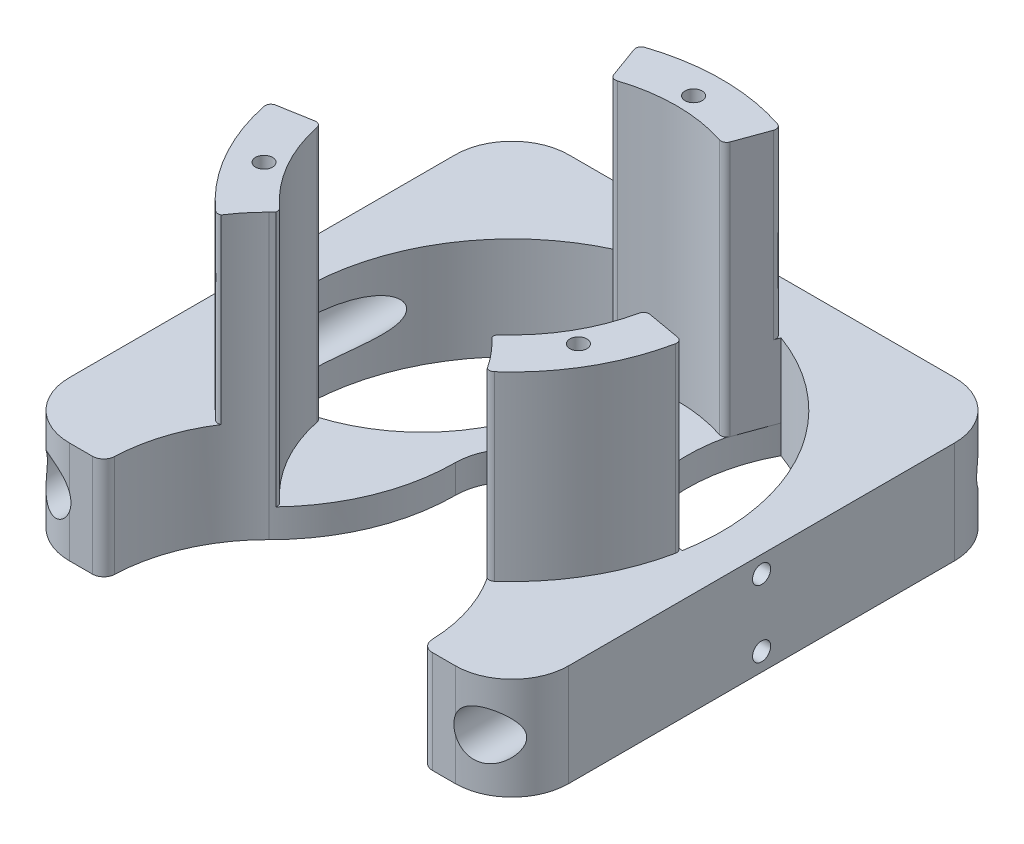
from build123d import *

# Parameters (mm, degrees)
SKETCH1_W           = 88
SKETCH1_H           = 88
BOSS_EXTRUDE1_DEPTH = 18
SKETCH2_R           = 4.25
CUT_EXTRUDE1_DEPTH  = 101.019998
FILLET1_R           = 10
SKETCH3_R           = 37
CUT_EXTRUDE2_DEPTH  = 65.776539126
SKETCH5_R           = 40.5
SKETCH5_R_2         = 10
BOSS_EXTRUDE2_DEPTH = 5
BOSS_EXTRUDE3_START = 45
BOSS_EXTRUDE3_DEPTH = 45
SKETCH7_R           = 1.5
CUT_EXTRUDE3_DEPTH  = 80.824808347
CIRPATTERN1_COUNT   = 3
CUT_EXTRUDE6_DEPTH  = 77.791926774
CIRPATTERN2_COUNT   = 3
FILLET4_R           = 1
SKETCH12_R          = 27.977706125
CUT_EXTRUDE8_DEPTH  = 80.824808284
CUT_EXTRUDE9_DEPTH  = 80.824808284
SKETCH14_R          = 4.25
CUT_EXTRUDE10_DEPTH = 111.36303741
FILLET5_R           = 2
CUT_EXTRUDE11_REACH = 112.363
SKETCH15_R          = 1.6


with BuildPart() as part:
    # Sketch1 → Boss-Extrude1 (new body)
    with BuildSketch(Plane(origin=(0, 0, 0), x_dir=(1, 0, 0), z_dir=(0, 1, 0))):
        Rectangle(SKETCH1_W, SKETCH1_H)
    extrude(amount=BOSS_EXTRUDE1_DEPTH)

    # Sketch2 → Cut-Extrude1 (cut, through all)
    with BuildSketch(Plane.XY.offset(44)):
        with Locations((-38, 9)):
            Circle(SKETCH2_R)
        with Locations(Location((38, 9, 0), (0, 0, 180))):
            Circle(SKETCH2_R)
    extrude(amount=-CUT_EXTRUDE1_DEPTH, mode=Mode.SUBTRACT)

    # Fillet1
    # the kernel refuses this fillet: 10 mm, written as the material it takes off along each edge
    with BuildSketch(Plane(origin=(44, -25, 44), x_dir=(-1, 0, 0), z_dir=(0, 1, 0)), Plane(origin=(44, -25, -44), x_dir=(0, 0, 1), z_dir=(0, 1, 0))) as fillet1_piece_1:
        with BuildLine():
            CenterArc((FILLET1_R, -FILLET1_R), FILLET1_R, 90, 90)
            Line((0, -FILLET1_R), (0, 0))
            Line((0, 0), (FILLET1_R, 0))
        make_face()
    extrude(amount=68, mode=Mode.SUBTRACT)
    with BuildSketch(Plane(origin=(-44, -25, 44), x_dir=(1, 0, 0), z_dir=(0, 1, 0)), Plane(origin=(-44, -25, -44), x_dir=(0, 0, 1), z_dir=(0, 1, 0))) as fillet1_piece_2:
        with BuildLine():
            CenterArc((FILLET1_R, FILLET1_R), FILLET1_R, 180, 90)
            Line((0, FILLET1_R), (0, 0))
            Line((0, 0), (FILLET1_R, 0))
        make_face()
    extrude(amount=68, mode=Mode.SUBTRACT)

    # Sketch3 → Cut-Extrude2 (cut, through all)
    with BuildSketch(Plane(origin=(0, 18, 0), x_dir=(1, 0, 0), z_dir=(0, 1, 0))):
        with Locations(Location((0, 0, 0), (0, 0, 270))):
            Circle(SKETCH3_R)
    extrude(amount=-CUT_EXTRUDE2_DEPTH, mode=Mode.SUBTRACT)

    # Sketch5 → Boss-Extrude2 (add)
    with BuildSketch(Plane(origin=(0, 0, 0), x_dir=(1, 0, 0), z_dir=(0, 1, 0))):
        Circle(SKETCH5_R)
        with Locations(Location((0, 0, 0), (0, 0, 270))):
            Circle(SKETCH5_R_2, mode=Mode.SUBTRACT)
    extrude(amount=BOSS_EXTRUDE2_DEPTH)

    # Sketch6 → Boss-Extrude3 (add)
    with BuildSketch(Plane(origin=(0, 5, 0), x_dir=(1, 0, 0), z_dir=(0, 1, 0)).offset(BOSS_EXTRUDE3_START)):
        with BuildLine():
            Line((-12.654745303, 34.768626969), (-9.918584156, 27.251086003))
            ThreePointArc((-9.918584156, 27.251086003), (0, 29), (9.918584156, 27.251086003))
            Line((9.918584156, 27.251086003), (12.654745303, 34.768626969))
            ThreePointArc((12.654745303, 34.768626969), (0, 37), (-12.654745303, 34.768626969))
        make_face()
    boss_extrude3 = extrude(amount=-BOSS_EXTRUDE3_DEPTH)

    # Sketch7 → Cut-Extrude3 (cut, through all)
    with BuildSketch(Plane(origin=(0, 50, 0), x_dir=(1, 0, 0), z_dir=(0, 1, 0))):
        with Locations(Location((0, 32, 0), (0, 0, 270))):
            Circle(SKETCH7_R)
    cut_extrude3 = extrude(amount=-CUT_EXTRUDE3_DEPTH, mode=Mode.SUBTRACT)

    # CirPattern1: Boss-Extrude3, Cut-Extrude3 ×3 about axis
    cirpattern1_axis = Axis((0, 0, 0), (0, 1, 0))
    add([boss_extrude3.rotate(cirpattern1_axis, i * 360 / CIRPATTERN1_COUNT) for i in range(1, CIRPATTERN1_COUNT)])
    add([cut_extrude3.rotate(cirpattern1_axis, i * 360 / CIRPATTERN1_COUNT) for i in range(1, CIRPATTERN1_COUNT)], mode=Mode.SUBTRACT)

    # Sketch10 → Cut-Extrude6 (cut, through all)
    with BuildSketch(Plane(origin=(0, 5, 0), x_dir=(1, 0, 0), z_dir=(0, 1, 0))):
        with BuildLine():
            ThreePointArc((12.654745303, 34.768626969), (13.077619626, 7.550367211), (36.437886861, -6.424982574))
            ThreePointArc((36.437886861, -6.424982574), (32.04293994, 18.5), (12.654745303, 34.768626969))
        make_face()
    cut_extrude6 = extrude(amount=-CUT_EXTRUDE6_DEPTH, mode=Mode.SUBTRACT)

    # CirPattern2: Cut-Extrude6 ×3 about axis
    cirpattern2_axis = Axis((0, 0, 0), (0, 1, 0))
    for i in range(1, CIRPATTERN2_COUNT):
        add(cut_extrude6.rotate(cirpattern2_axis, i * 360 / CIRPATTERN2_COUNT), mode=Mode.SUBTRACT)

    # Fillet4
    # the kernel refuses this fillet: 1 mm, written as the material it takes off along each edge
    with BuildSketch(Plane(origin=(12.654745303, 52.569692353, -34.768626969), x_dir=(-0.9443527030800373, 0, -0.32893460168463146), z_dir=(0, -1, 0)), Plane(origin=(-36.437886861, 52.569692353, 6.424982574), x_dir=(0.18731063029741038, 0, 0.9823007318421313), z_dir=(0, -1, 0)), Plane(origin=(23.783141558, 52.569692353, 28.343644395), x_dir=(0.757042072782625, 0, -0.6533661301574996), z_dir=(0, -1, 0))) as fillet4_piece_1:
        with BuildLine():
            CenterArc((1.013986712, -0.999903526), FILLET4_R, 89.204122912, 91.591754177)
            Line((0.014083186, -1.013793755), (0, 0))
            ThreePointArc((0, 0), (0.513938471, 0.003569534), (1.027876941, 0))
        make_face()
    extrude(amount=34.569692353, mode=Mode.SUBTRACT)
    with BuildSketch(Plane(origin=(-12.654745303, 52.569692353, -34.768626969), x_dir=(0.9443527030800395, 0, -0.328934601684625), z_dir=(0, -1, 0)), Plane(origin=(-23.783141558, 52.569692353, 28.343644395), x_dir=(-0.7570420727826231, 0, -0.6533661301575017), z_dir=(0, -1, 0)), Plane(origin=(36.437886861, 52.569692353, 6.424982574), x_dir=(-0.1873106302974209, 0, 0.9823007318421294), z_dir=(0, -1, 0))) as fillet4_piece_2:
        with BuildLine():
            CenterArc((1.013986712, 0.999903526), FILLET4_R, 179.204122912, 91.591754177)
            Line((0.014083186, 1.013793755), (0, 0))
            ThreePointArc((0, 0), (0.513938471, -0.003569534), (1.027876941, 0))
        make_face()
    extrude(amount=34.569692353, mode=Mode.SUBTRACT)
    with BuildSketch(Plane(origin=(-9.918584156, 52.458321753, -27.251086003), x_dir=(-0.3420201433256635, 0, -0.9396926207859103), z_dir=(0, -1, 0)), Plane(origin=(-18.640840681, 52.458321753, 22.21528885), x_dir=(-0.6427876096865464, 0, 0.7660444431189721), z_dir=(0, -1, 0)), Plane(origin=(28.559424837, 52.458321753, 5.035797152), x_dir=(0.9848077530122067, 0, 0.17364817766693766), z_dir=(0, -1, 0))) as fillet4_piece_3:
        with BuildLine():
            CenterArc((0.983328701, 1), FILLET4_R, 181.910213172, 88.089786828)
            ThreePointArc((-0.016115589, 0.966666667), (-0.004029177, 0.483400496), (0, 0))
            Line((0, 0), (0.983328701, 0))
        make_face()
    extrude(amount=47.458321753, mode=Mode.SUBTRACT)
    with BuildSketch(Plane(origin=(9.918584156, 52.458321753, -27.251086003), x_dir=(0.34202014332567005, 0, -0.9396926207859079), z_dir=(0, -1, 0)), Plane(origin=(-28.559424837, 52.458321753, 5.035797152), x_dir=(-0.9848077530122082, 0, 0.17364817766692905), z_dir=(0, -1, 0)), Plane(origin=(18.640840681, 52.458321753, 22.21528885), x_dir=(0.642787609686538, 0, 0.7660444431189791), z_dir=(0, -1, 0))) as fillet4_piece_4:
        with BuildLine():
            CenterArc((0.983328701, -1), FILLET4_R, 90, 88.089786828)
            ThreePointArc((-0.016115589, -0.966666667), (-0.004029177, -0.483400496), (0, 0))
            Line((0, 0), (0.983328701, 0))
        make_face()
    extrude(amount=47.458321753, mode=Mode.SUBTRACT)

    # Sketch12 → Cut-Extrude8 (cut, through all)
    with BuildSketch(Plane(origin=(0, 0, 0), x_dir=(1, 0, 0), z_dir=(0, 1, 0))):
        with Locations((0, -43.078440548)):
            Circle(SKETCH12_R)
    extrude(amount=CUT_EXTRUDE8_DEPTH, mode=Mode.SUBTRACT)

    # Sketch13 → Cut-Extrude9 (cut, through all)
    with BuildSketch(Plane(origin=(0, 0, 0), x_dir=(1, 0, 0), z_dir=(0, 1, 0))):
        with BuildLine():
            ThreePointArc((-10, 0), (0, -10), (10, 0))
            ThreePointArc((10, 0), (12.516559025, -12.564476209), (19.677986964, -23.190532939))
            ThreePointArc((19.677986964, -23.190532939), (0, -15.100734422), (-19.677986964, -23.190532939))
            ThreePointArc((-19.677986964, -23.190532939), (-12.516559025, -12.564476209), (-10, 0))
        make_face()
    extrude(amount=CUT_EXTRUDE9_DEPTH, mode=Mode.SUBTRACT)

    # Sketch14 → Cut-Extrude10 (cut, through all)
    with BuildSketch(Plane(origin=(0, 0, -44), x_dir=(-1, 0, 0), z_dir=(0, 0, -1))):
        with Locations(Location((-38, 9, 0), (0, 0, 340.250077204))):
            Circle(SKETCH14_R)
        with Locations(Location((38, 9, 0), (0, 0, 199.749922796))):
            Circle(SKETCH14_R)
    extrude(amount=-CUT_EXTRUDE10_DEPTH, mode=Mode.SUBTRACT)

    # Fillet5
    fillet5_edges = [part.edges().sort_by_distance(p)[0] for p in [
        (27.962524354, 9, 44),
        (-27.962524354, 9, 44),
    ]]
    fillet(fillet5_edges, radius=FILLET5_R)

    # Sketch15 → Cut-Extrude11 (cut, up to next)
    with BuildSketch(Plane(origin=(44, 0, 0), x_dir=(0, 0, -1), z_dir=(1, 0, 0)), mode=Mode.PRIVATE) as cut_extrude11_sk1:
        with Locations((0, 15)):
            Circle(SKETCH15_R)
    cut_extrude11_tool1 = extrude(cut_extrude11_sk1.sketch, amount=-CUT_EXTRUDE11_REACH, mode=Mode.PRIVATE) & part.part
    # Sketch15 → Cut-Extrude11 (cut, up to next)
    with BuildSketch(Plane(origin=(44, 0, 0), x_dir=(0, 0, -1), z_dir=(1, 0, 0)), mode=Mode.PRIVATE) as cut_extrude11_sk2:
        with Locations((0, 3.2)):
            Circle(SKETCH15_R)
    cut_extrude11_tool2 = extrude(cut_extrude11_sk2.sketch, amount=-CUT_EXTRUDE11_REACH, mode=Mode.PRIVATE) & part.part
    cut_extrude11_1 = cut_extrude11_tool1.solids().sort_by_distance((44, 15, 0))[0]
    add(cut_extrude11_1, mode=Mode.SUBTRACT)
    cut_extrude11_2 = cut_extrude11_tool2.solids().sort_by_distance((44, 3.2, 0))[0]
    add(cut_extrude11_2, mode=Mode.SUBTRACT)
    cut_extrude11 = cut_extrude11_1 + cut_extrude11_2  # Cut-Extrude11 as one shape, for the pattern or mirror that repeats it

    # Mirror1: Cut-Extrude11 across plane
    add(cut_extrude11.mirror(Plane(origin=(0, 0, 0), x_dir=(0, 0, 1), z_dir=(1, 0, 0))), mode=Mode.SUBTRACT)


solid = part.part
